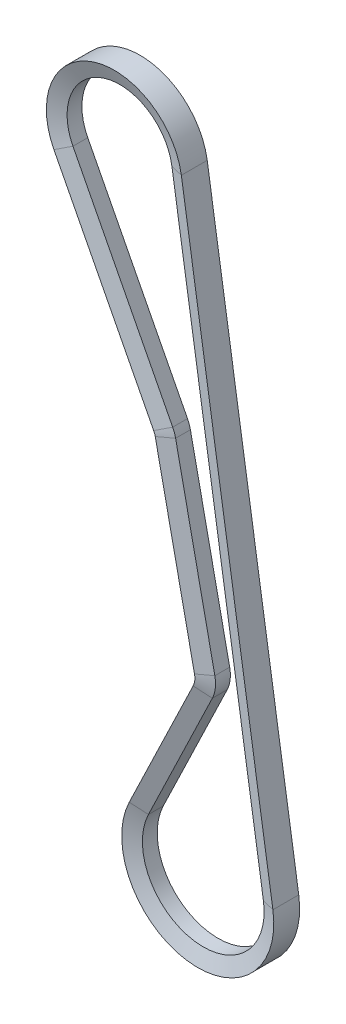
from build123d import *


with BuildPart() as part:
    # Sweep1: sweep along a path in Sketch2
    with BuildLine(Plane.XY) as sweep1_path:
        Line((24.704731455, 3.830958591), (58.414032488, -213.550464313))
        ThreePointArc((58.414032488, -213.550464313), (26.627460499, -245.536770533), (5.520116954, -205.687178403))
        Line((5.520116954, -205.687178403), (29.052852894, -156.846779262))
        ThreePointArc((29.052852894, -156.846779262), (29.636244536, -154.853591749), (29.54532437, -152.778772288))
        Line((29.54532437, -152.778772288), (15.086051824, -84.288412109))
        ThreePointArc((15.086051824, -84.288412109), (14.855016165, -83.469826969), (14.516652197, -82.689462354))
        Line((14.516652197, -82.689462354), (-22.219112106, -11.459103683))
        ThreePointArc((-22.219112106, -11.459103683), (-7.745390692, 23.769916345), (24.704731455, 3.830958591))
    # Sketch3 → Sweep1 (sweep)
    with BuildSketch(Plane(origin=(-22.219112106, -11.459103683, 0), x_dir=(0.8887644842509673, 0.4583641473044247, 0), z_dir=(-0.4583641473044247, 0.8887644842509673, 0))):
        Polygon((0, -4.7625), (0, 4.7625), (5.588, 2.728634331), (5.588, -2.728634331), align=None)
    sweep(path=sweep1_path.line)


solid = part.part
